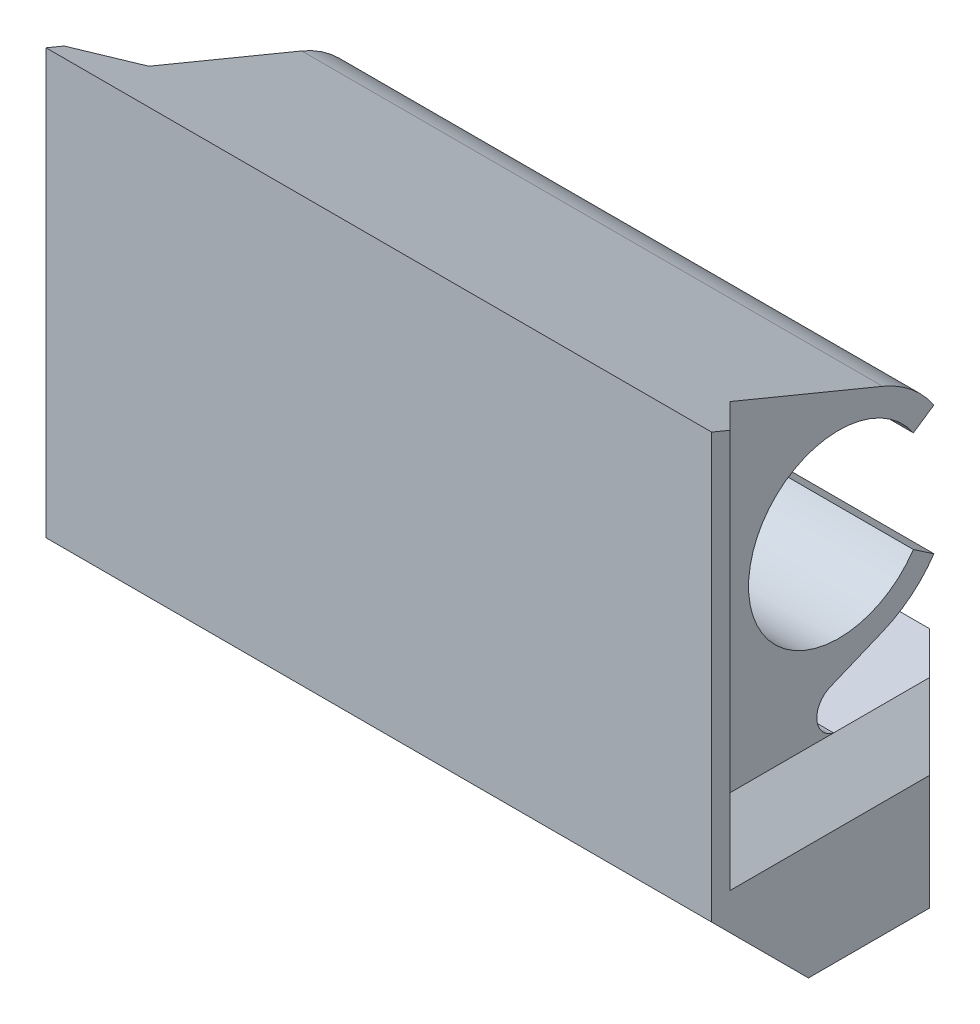
from build123d import *

# Parameters (mm, degrees)
SKETCH1_W           = 55
SKETCH1_H           = 45
BOSS_EXTRUDE1_DEPTH = 5
SKETCH3_W           = 55
SKETCH3_H           = 13
BOSS_EXTRUDE5_DEPTH = 20
CHAMFER1_SIZE       = 8
SKETCH5_R           = 4.5
CUT_EXTRUDE2_DEPTH  = 8
BOSS_EXTRUDE7_DEPTH = 48
CUT_EXTRUDE3_DEPTH  = 71.205777697
CHAMFER2_SIZE       = 3.5
CHAMFER3_SIZE       = 3.5
CHAMFER4_SIZE       = 7
BOSS_EXTRUDE8_DEPTH = 3


with BuildPart() as part:
    # Sketch1 → Boss-Extrude1 (new body)
    with BuildSketch(Plane.XY):
        with Locations((17.145774036, 16.279520652)):
            Rectangle(SKETCH1_W, SKETCH1_H)
    extrude(amount=BOSS_EXTRUDE1_DEPTH)

    # Sketch3 → Boss-Extrude5 (add)
    with BuildSketch(Plane(origin=(0, 0, 0), x_dir=(-1, 0, 0), z_dir=(0, 0, -1))):
        with Locations((-17.145774036, 0.279520652)):
            Rectangle(SKETCH3_W, SKETCH3_H)
    extrude(amount=BOSS_EXTRUDE5_DEPTH)

    # Chamfer1
    chamfer1_edges = [part.edges().sort_by_distance(p)[0] for p in [
        (17.145774036, -6.220479348, 5),
    ]]
    chamfer(chamfer1_edges, length=CHAMFER1_SIZE)

    # Sketch5 → Cut-Extrude2 (cut)
    with BuildSketch(Plane.XZ.offset(6.220479348)):
        with Locations(Location((-0.354225964, -11, 0), (0, 0, 270))):
            Circle(SKETCH5_R)
        with Locations(Location((34.645774036, -11, 0), (0, 0, 270))):
            Circle(SKETCH5_R)
    extrude(amount=-CUT_EXTRUDE2_DEPTH, mode=Mode.SUBTRACT)

    # Sketch7 → Boss-Extrude7 (add)
    with BuildSketch(Plane.ZY.offset(6.854225964)):
        with BuildLine():
            Line((-8.308177677, 10.21387745), (-12.629175087, 12.000050953))
            ThreePointArc((-12.629175087, 12.000050953), (-15.003318067, 13.416764905), (-16.86901604, 15.457060078))
            Line((-16.86901604, 15.457060078), (-15.17096521, 16.605591044))
            ThreePointArc((-15.17096521, 16.605591044), (-1.55, 20.779520652), (-15.17096521, 24.95345026))
            Line((-15.17096521, 24.95345026), (-16.86901604, 26.101981226))
            ThreePointArc((-16.86901604, 26.101981226), (-15.003318067, 28.142276398), (-12.629175087, 29.55899035))
            Line((-12.629175087, 29.55899035), (0, 34.779520652))
            Line((0, 34.779520652), (0, 6.779520652))
            Line((0, 6.779520652), (-8.576470695, 6.779520652))
            ThreePointArc((-8.576470695, 6.779520652), (-7.194534972, 8.39922137), (-8.308177677, 10.21387745))
        make_face()
    extrude(amount=-BOSS_EXTRUDE7_DEPTH)

    # Sketch8 → Cut-Extrude3 (cut, through all)
    with BuildSketch(Plane.ZY.offset(10.354225964)):
        Polygon((0, 34.779520652), (5, 36.846373896), (5, 38.779520652), (0, 38.779520652), align=None)
    extrude(amount=-CUT_EXTRUDE3_DEPTH, mode=Mode.SUBTRACT)

    # Chamfer2
    chamfer2_edges = [part.edges().sort_by_distance(p)[0] for p in [
        (-10.354225964, 6.779520652, -10),
        (-10.354225964, 20.779520652, 0),
    ]]
    chamfer(chamfer2_edges, length=CHAMFER2_SIZE - 0.0001)  # a hair under: the kernel refuses the full size

    # Chamfer3
    chamfer3_edges = [part.edges().sort_by_distance(p)[0] for p in [
        (44.645774036, 20.779520652, 0),
        (44.645774036, 6.779520652, -10),
    ]]
    chamfer(chamfer3_edges, length=CHAMFER3_SIZE - 0.0001)  # a hair under: the kernel refuses the full size

    # Chamfer4
    chamfer4_edges = [part.edges().sort_by_distance(p)[0] for p in [
        (44.645774036, -1.470429348, -20),
        (-10.354225964, -1.470429348, -20),
    ]]
    chamfer(chamfer4_edges, length=CHAMFER4_SIZE)

    # Sketch9 → Boss-Extrude8 (add)
    with BuildSketch(Plane.ZY.offset(6.854225964)):
        with BuildLine():
            Line((-15.17096521, 24.95345026), (-12.313269912, 23.020556683))
            ThreePointArc((-12.313269912, 23.020556683), (-5, 20.779520652), (-12.313269912, 18.538484621))
            Line((-12.313269912, 18.538484621), (-15.17096521, 16.605591044))
            ThreePointArc((-15.17096521, 16.605591044), (-1.55, 20.779520652), (-15.17096521, 24.95345026))
        make_face()
    extrude(amount=-BOSS_EXTRUDE8_DEPTH)


solid = part.part
